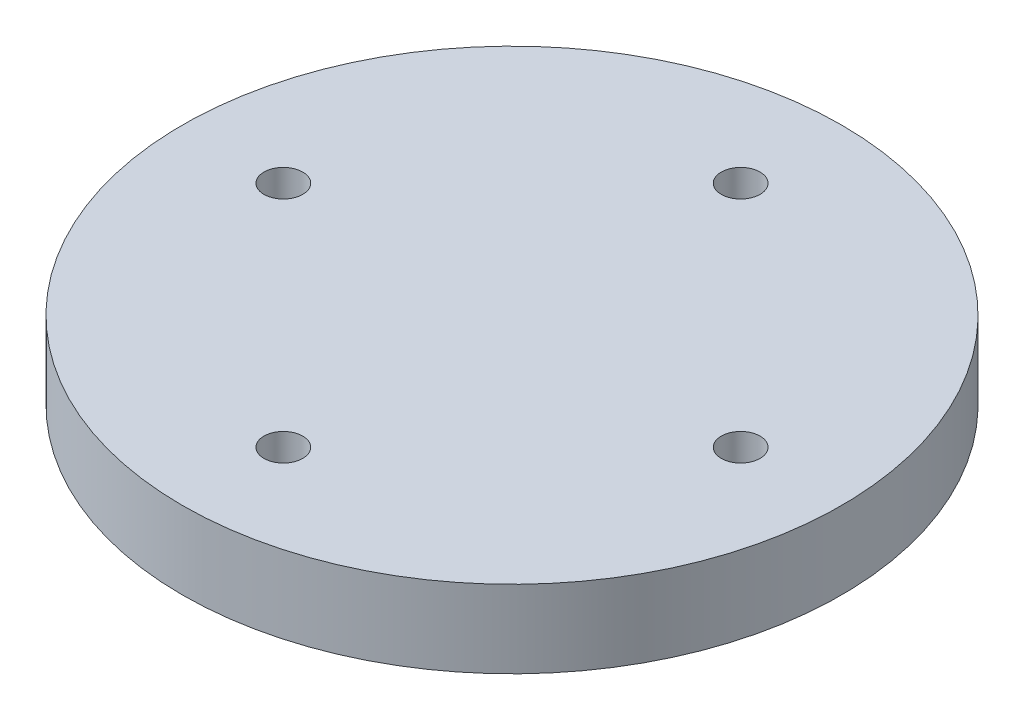
from build123d import *

# Parameters (mm, degrees)
SKETCH_1_R          = 42.5
EXTRUDE_1_DEPTH     = 10
SKETCH_2_R          = 7
CUT_EXTRUDE_1_DEPTH = 6
SKETCH_3_R          = 2.5
CUT_EXTRUDE_2_DEPTH = 6


with BuildPart() as part:
    # Эскиз1 → Вытянуть1 (new body)
    with BuildSketch(Plane(origin=(0, 0, 0), x_dir=(1, 0, 0), z_dir=(0, 1, 0))):
        Circle(SKETCH_1_R)
    extrude(amount=EXTRUDE_1_DEPTH)

    # Эскиз2 → Вырез-Вытянуть1 (cut)
    with BuildSketch(Plane.XZ):
        with Locations((-29.48960133, 0)):
            Circle(SKETCH_2_R)
        with Locations((0, 29.48960133)):
            Circle(SKETCH_2_R)
        with Locations((29.48960133, 0)):
            Circle(SKETCH_2_R)
        with Locations((0, -29.48960133)):
            Circle(SKETCH_2_R)
    extrude(amount=-CUT_EXTRUDE_1_DEPTH, mode=Mode.SUBTRACT)

    # Эскиз3 → Вырез-Вытянуть2 (cut)
    with BuildSketch(Plane.XZ.offset(-6)):
        with Locations((-29.48960133, 0)):
            Circle(SKETCH_3_R)
        with Locations((0, 29.48960133)):
            Circle(SKETCH_3_R)
        with Locations((29.48960133, 0)):
            Circle(SKETCH_3_R)
        with Locations((0, -29.48960133)):
            Circle(SKETCH_3_R)
    extrude(amount=-CUT_EXTRUDE_2_DEPTH, mode=Mode.SUBTRACT)


solid = part.part
